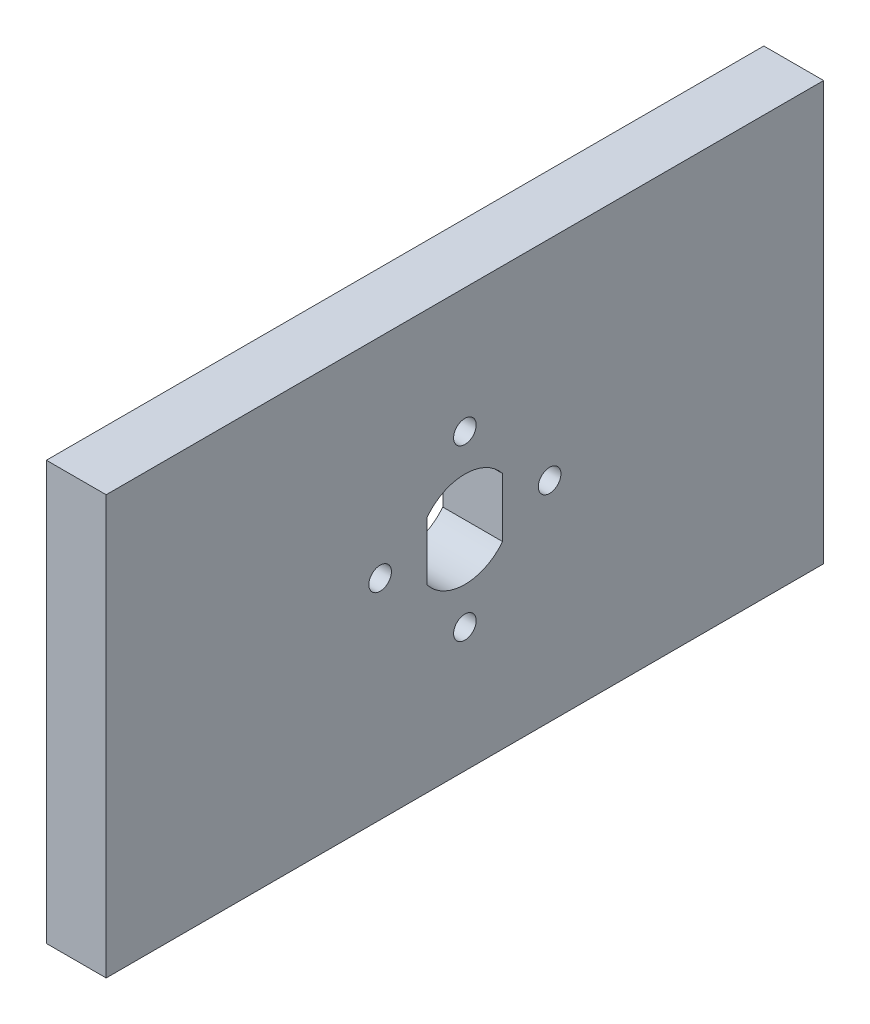
from build123d import *

# Parameters (mm, degrees)
SKETCH1_W               = 76.2
SKETCH1_H               = 44.45
BOSS_EXTRUDE1_DEPTH     = 3.175
CUT_EXTRUDE1_DEPTH      = 45.563248591
CUT_EXTRUDE1_DEPTH_BACK = 45.563248591
ADVANCEDHOLE1_START     = -3.175
ADVANCEDHOLE1_OUTLINE_R = 1.2
ADVANCEDHOLE1_DEPTH     = 6.35


# Read off the part's stored shape, not the designer's step: AdvancedHole1
with BuildPart() as part:
    # Sketch1 → Boss-Extrude1 (new, symmetric)
    with BuildSketch(Plane(origin=(0, 0, 0), x_dir=(0, 0, -1), z_dir=(1, 0, 0))):
        Rectangle(SKETCH1_W, SKETCH1_H)
    extrude(amount=BOSS_EXTRUDE1_DEPTH, both=True)

    # Sketch2 → Cut-Extrude1 (cut, two sides: drawn at the far end of the back side and taken through both)
    with BuildSketch(Plane(origin=(3.175, 0, 0), x_dir=(0, 0, -1), z_dir=(1, 0, 0)).offset(-CUT_EXTRUDE1_DEPTH_BACK)):
        with BuildLine():
            ThreePointArc((4.0005, 3.130878431), (0, 5.08), (-4.0005, 3.130878431))
            Line((-4.0005, 3.130878431), (-4.0005, -3.130878431))
            ThreePointArc((-4.0005, -3.130878431), (0, -5.08), (4.0005, -3.130878431))
            Line((4.0005, -3.130878431), (4.0005, 3.130878431))
        make_face()
    extrude(amount=CUT_EXTRUDE1_DEPTH + CUT_EXTRUDE1_DEPTH_BACK, mode=Mode.SUBTRACT)

    # AdvancedHole1 outline → AdvancedHole1 (cut)
    with BuildSketch(Plane.YZ.offset(ADVANCEDHOLE1_START)):
        with Locations((-9, 0)):
            Circle(ADVANCEDHOLE1_OUTLINE_R)
        with Locations((0, 9)):
            Circle(ADVANCEDHOLE1_OUTLINE_R)
        with Locations((9, 0)):
            Circle(ADVANCEDHOLE1_OUTLINE_R)
        with Locations((0, -9)):
            Circle(ADVANCEDHOLE1_OUTLINE_R)
    extrude(amount=ADVANCEDHOLE1_DEPTH, mode=Mode.SUBTRACT)


solid = part.part
